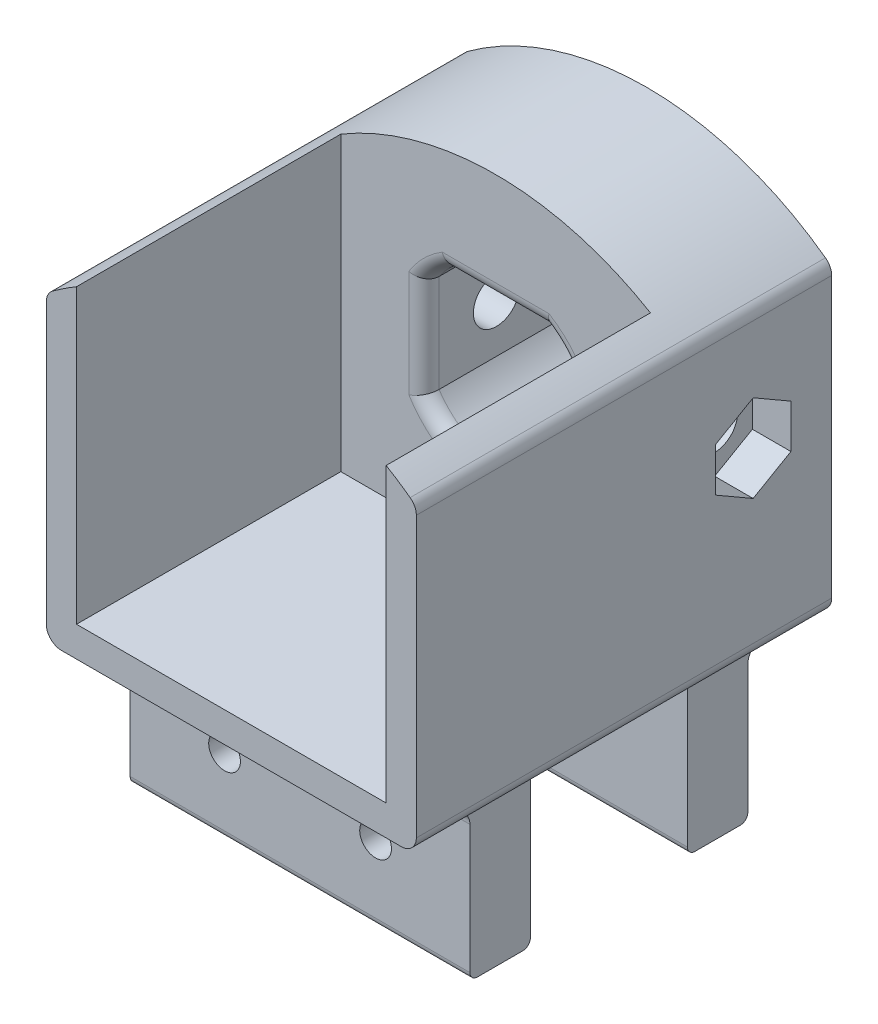
from build123d import *
from build123d.topology import SkipClean

# Parameters (mm, degrees)
EXTRUDE_1_DEPTH          = 20
EXTRUDE_2_DEPTH          = 35
FILLET_1_R               = 2
FILLET_2_R               = 2
SKETCH_3_W               = 55
SKETCH_3_H               = 8
EXTRUDE_3_DEPTH          = 20
CUT_EXTRUDE_1_DEPTH      = 81.785122448
FILLET_3_R               = 2
CUT_EXTRUDE_2_DEPTH      = 92.549767886
CUT_EXTRUDE_2_DEPTH_BACK = 92.549767886
SKETCH_6_R               = 3.05
CUT_EXTRUDE_3_DEPTH      = 5.1
FILLET_3_OF_MIRROR_1_R   = 2
CUT_EXTRUDE_4_DEPTH      = 75.837223358
CUT_EXTRUDE_4_DEPTH_BACK = 75.837223358
SKETCH_9_R               = 1.6
SKETCH_10_R              = 3
CUT_EXTRUDE_5_DEPTH      = 3
CUT_EXTRUDE_START        = -2
SKETCH_11_R              = 3
CUT_EXTRUDE_6_DEPTH      = 2
CUT_EXTRUDE_7_DEPTH      = 75.837223358
CUT_EXTRUDE_7_DEPTH_BACK = 75.837223358
SKETCH_12_W              = 29.59816484
SKETCH_12_H              = 37.248372047
SKETCH_12_W_2            = 30.6542071
SKETCH_12_H_2            = 41.472541085
SKETCH_13_W              = 45
SKETCH_13_H              = 8
EXTRUDE_4_DEPTH          = 20
CUT_EXTRUDE_8_DEPTH      = 69.398976601
CUT_EXTRUDE_8_DEPTH_BACK = 69.398976601
SKETCH_14_R              = 2.1
FILLET_5_R               = 1
FILLET_6_R               = 2


with BuildPart() as part:
    # 草图1 → 凸台-拉伸1 (new body)
    with BuildSketch(Plane.XY):
        with BuildLine():
            Line((-24.5, -24.4), (24.5, -24.4))
            Line((24.5, -24.4), (24.5, 15.6))
            ThreePointArc((24.5, 15.6), (0, 23.936691271), (-24.5, 15.6))
            Line((-24.5, 15.6), (-24.5, -24.4))
        make_face()
        with BuildLine():
            Line((-6.480740698, 9.5), (6.480740698, 9.5))
            ThreePointArc((6.480740698, 9.5), (8.131727984, 8.131727984), (9.5, 6.480740698))
            Line((9.5, 6.480740698), (9.5, -6.480740698))
            ThreePointArc((9.5, -6.480740698), (8.131727984, -8.131727984), (6.480740698, -9.5))
            Line((6.480740698, -9.5), (-6.480740698, -9.5))
            ThreePointArc((-6.480740698, -9.5), (-8.131727984, -8.131727984), (-9.5, -6.480740698))
            Line((-9.5, -6.480740698), (-9.5, 6.480740698))
            ThreePointArc((-9.5, 6.480740698), (-8.131727984, 8.131727984), (-6.480740698, 9.5))
        make_face(mode=Mode.SUBTRACT)
    extrude(amount=EXTRUDE_1_DEPTH)

    # 草图2 → 凸台-拉伸2 (add)
    with SkipClean():  # the faces are left unmerged after this step: merging them gives an invalid solid
        with BuildSketch(Plane.XY.offset(20)):
            with BuildLine():
                Line((-20.5, 18.311818868), (-20.5, -20.4))
                Line((-20.5, -20.4), (20.5, -20.4))
                Line((20.5, -20.4), (20.5, 18.311818868))
                ThreePointArc((20.5, 18.311818868), (22.540818317, 17.016117462), (24.5, 15.6))
                Line((24.5, 15.6), (24.5, -24.4))
                Line((24.5, -24.4), (-24.5, -24.4))
                Line((-24.5, -24.4), (-24.5, 15.6))
                ThreePointArc((-24.5, 15.6), (-22.540818317, 17.016117462), (-20.5, 18.311818868))
            make_face()
        extrude(amount=EXTRUDE_2_DEPTH)

    # 圆角1
    fillet_1_edges = [part.edges().sort_by_distance(p)[0] for p in [
        (-24.5, 15.6, 37.5),
        (24.5, 15.6, 37.5),
        (24.5, -24.4, 37.5),
        (-24.5, -24.4, 37.5),
    ]]
    fillet(fillet_1_edges, radius=FILLET_1_R)

    # 圆角2
    fillet_2_edges = [part.edges().sort_by_distance(p)[0] for p in [
        (8.131727984, 8.131727984, 20),
        (0, 9.5, 20),
        (-8.131727984, 8.131727984, 20),
        (-9.5, 0, 20),
        (-8.131727984, -8.131727984, 20),
        (0, -9.5, 20),
        (8.131727984, -8.131727984, 20),
        (9.5, 0, 20),
    ]]
    fillet(fillet_2_edges, radius=FILLET_2_R)

    # 草图3 → 凸台-拉伸3 (add)
    with SkipClean():  # the faces are left unmerged after this step: merging them gives an invalid solid
        with BuildSketch(Plane.ZY.offset(24.5)):
            with Locations((27.5, 10.599820628)):
                Rectangle(SKETCH_3_W, SKETCH_3_H)
            with Locations((27.5, -18.000179372)):
                Rectangle(SKETCH_3_W, SKETCH_3_H)
        extrude_3 = extrude(amount=EXTRUDE_3_DEPTH)

    # 草图4 → 切除-拉伸1 (cut, symmetric)
    with SkipClean():  # the faces are left unmerged after this step: merging them gives an invalid solid
        with BuildSketch(Plane(origin=(0, 14.599820628, 0), x_dir=(1, 0, 0), z_dir=(0, 1, 0))):
            with BuildLine():
                Line((-39.25, -11.75), (-29.75, -11.75))
                ThreePointArc((-29.75, -11.75), (-29.042893219, -12.042893219), (-28.75, -12.75))
                Line((-28.75, -12.75), (-28.75, -17.25))
                ThreePointArc((-28.75, -17.25), (-29.042893219, -17.957106781), (-29.75, -18.25))
                Line((-29.75, -18.25), (-39.25, -18.25))
                ThreePointArc((-39.25, -18.25), (-39.957106781, -17.957106781), (-40.25, -17.25))
                Line((-40.25, -17.25), (-40.25, -12.75))
                ThreePointArc((-40.25, -12.75), (-39.957106781, -12.042893219), (-39.25, -11.75))
            make_face()
            with BuildLine():
                Line((-39.25, -36.75), (-29.75, -36.75))
                ThreePointArc((-29.75, -36.75), (-29.042893219, -37.042893219), (-28.75, -37.75))
                Line((-28.75, -37.75), (-28.75, -42.25))
                ThreePointArc((-28.75, -42.25), (-29.042893219, -42.957106781), (-29.75, -43.25))
                Line((-29.75, -43.25), (-39.25, -43.25))
                ThreePointArc((-39.25, -43.25), (-39.957106781, -42.957106781), (-40.25, -42.25))
                Line((-40.25, -42.25), (-40.25, -37.75))
                ThreePointArc((-40.25, -37.75), (-39.957106781, -37.042893219), (-39.25, -36.75))
            make_face()
        cut_extrude_1 = extrude(amount=CUT_EXTRUDE_1_DEPTH, both=True, mode=Mode.SUBTRACT)

    # 圆角3
    fillet_3_edges = [part.edges().sort_by_distance(p)[0] for p in [
        (-44.5, 6.599820628, 27.5),
        (-44.5, 14.599820628, 27.5),
        (-44.5, -14.000179372, 27.5),
        (-44.5, -22.000179372, 27.5),
    ]]
    fillet(fillet_3_edges, radius=FILLET_3_R)

    # 草图6 → 切除-拉伸2 (cut, two sides: drawn at the far end of the back side and taken through both)
    with BuildSketch(Plane(origin=(24.5, 0, 0), x_dir=(0, 0, -1), z_dir=(1, 0, 0)).offset(-CUT_EXTRUDE_2_DEPTH_BACK)):
        with Locations(Location((-10.4, 0, 0), (0, 0, 270))):
            Circle(SKETCH_6_R)
    extrude(amount=CUT_EXTRUDE_2_DEPTH + CUT_EXTRUDE_2_DEPTH_BACK, mode=Mode.SUBTRACT)

    # 草图7 → 切除-拉伸3 (cut)
    with BuildSketch(Plane(origin=(24.5, 0, 0), x_dir=(0, 0, -1), z_dir=(1, 0, 0))):
        Polygon((-5.4, -2.886751346), (-5.4, 2.886751346), (-10.4, 5.773502692), (-15.4, 2.886751346), (-15.4, -2.886751346), (-10.4, -5.773502692), align=None)
    cut_extrude_3 = extrude(amount=-CUT_EXTRUDE_3_DEPTH, mode=Mode.SUBTRACT)

    # 镜向1: 凸台-拉伸3, 切除-拉伸1, 切除-拉伸3 across plane
    add(extrude_3.mirror(Plane(origin=(0, 0, 0), x_dir=(0, 0, 1), z_dir=(1, 0, 0))))
    add(cut_extrude_1.mirror(Plane(origin=(0, 0, 0), x_dir=(0, 0, 1), z_dir=(1, 0, 0))), mode=Mode.SUBTRACT)
    add(cut_extrude_3.mirror(Plane(origin=(0, 0, 0), x_dir=(0, 0, 1), z_dir=(1, 0, 0))), mode=Mode.SUBTRACT)

    # 圆角3 of 镜向1
    fillet_3_of_mirror_1_edges = [part.edges().sort_by_distance(p)[0] for p in [
        (44.5, 6.599820628, 27.5),
        (44.5, 14.599820628, 27.5),
        (44.5, -14.000179372, 27.5),
        (44.5, -22.000179372, 27.5),
    ]]
    fillet(fillet_3_of_mirror_1_edges, radius=FILLET_3_OF_MIRROR_1_R)

    # 草图9 → 切除-拉伸4 (cut, two sides: drawn at the far end of the back side and taken through both)
    with BuildSketch(Plane(origin=(0, 0, 0), x_dir=(-1, 0, 0), z_dir=(0, 0, -1)).offset(-CUT_EXTRUDE_4_DEPTH_BACK)):
        with Locations((34.5, -18.000179372)):
            Circle(SKETCH_9_R)
        with Locations((34.5, 10.599820628)):
            Circle(SKETCH_9_R)
        with Locations((-34.5, 10.599820628)):
            Circle(SKETCH_9_R)
        with Locations((-34.5, -18.000179372)):
            Circle(SKETCH_9_R)
    extrude(amount=CUT_EXTRUDE_4_DEPTH + CUT_EXTRUDE_4_DEPTH_BACK, mode=Mode.SUBTRACT)

    # 草图10 → 切除-拉伸5 (cut)
    with BuildSketch(Plane(origin=(0, 0, 0), x_dir=(-1, 0, 0), z_dir=(0, 0, -1))):
        with Locations((34.5, 10.599820628)):
            Circle(SKETCH_10_R)
        with Locations((34.5, -18.000179372)):
            Circle(SKETCH_10_R)
        with Locations((-34.5, -18.000179372)):
            Circle(SKETCH_10_R)
        with Locations((-34.5, 10.599820628)):
            Circle(SKETCH_10_R)
    extrude(amount=-CUT_EXTRUDE_5_DEPTH, mode=Mode.SUBTRACT)

    # 草图11 → 切除-拉伸6 (cut)
    with BuildSketch(Plane.XY.offset(55).offset(CUT_EXTRUDE_START)):
        with Locations(Location((34.5, 10.599820628, 0), (0, 0, 180))):
            Circle(SKETCH_11_R)
        with Locations(Location((34.5, -18.000179372, 0), (0, 0, 180))):
            Circle(SKETCH_11_R)
        with Locations(Location((-34.5, -18.000179372, 0), (0, 0, 180))):
            Circle(SKETCH_11_R)
        with Locations(Location((-34.5, 10.599820628, 0), (0, 0, 180))):
            Circle(SKETCH_11_R)
    extrude(amount=CUT_EXTRUDE_6_DEPTH, mode=Mode.SUBTRACT)

    # 草图12 → 切除-拉伸7 (cut, two sides: drawn at the far end of the back side and taken through both)
    with BuildSketch(Plane(origin=(0, 0, 0), x_dir=(-1, 0, 0), z_dir=(0, 0, -1)).offset(-CUT_EXTRUDE_7_DEPTH_BACK)):
        with Locations((-39.29908242, -4.024365395)):
            Rectangle(SKETCH_12_W, SKETCH_12_H)
        with Locations((39.82710355, -6.136449915)):
            Rectangle(SKETCH_12_W_2, SKETCH_12_H_2)
    extrude(amount=CUT_EXTRUDE_7_DEPTH + CUT_EXTRUDE_7_DEPTH_BACK, mode=Mode.SUBTRACT)

    # 草图13 → 凸台-拉伸4 (add)
    with BuildSketch(Plane.XZ.offset(24.4)):
        with Locations((0, 41.9)):
            Rectangle(SKETCH_13_W, SKETCH_13_H)
        with Locations((0, 13.1)):
            Rectangle(SKETCH_13_W, SKETCH_13_H)
    extrude(amount=EXTRUDE_4_DEPTH)

    # 草图14 → 切除-拉伸8 (cut, two sides: drawn at the far end of the back side and taken through both)
    with BuildSketch(Plane.XY.offset(45.9).offset(-CUT_EXTRUDE_8_DEPTH_BACK)):
        with Locations((-10, -34.4)):
            Circle(SKETCH_14_R)
        with Locations((10, -34.4)):
            Circle(SKETCH_14_R)
    extrude(amount=CUT_EXTRUDE_8_DEPTH + CUT_EXTRUDE_8_DEPTH_BACK, mode=Mode.SUBTRACT)

    # 圆角5
    fillet_5_edges = [part.edges().sort_by_distance(p)[0] for p in [
        (0, -44.4, 37.9),
        (0, -44.4, 45.9),
        (0, -44.4, 9.1),
        (0, -44.4, 17.1),
    ]]
    fillet(fillet_5_edges, radius=FILLET_5_R)

    # 圆角6
    # the kernel refuses this fillet: 2 mm, written as the material it adds along each edge
    with BuildSketch(Plane(origin=(-22.5, -24.4, 45.9), x_dir=(0, -1, 0), z_dir=(1, 0, 0))) as fillet_6_piece_1:
        with BuildLine():
            CenterArc((FILLET_6_R, -FILLET_6_R), FILLET_6_R, 90, 90)
            Line((0, -FILLET_6_R), (0, 0))
            Line((0, 0), (FILLET_6_R, 0))
        make_face()
    extrude(amount=45)
    with BuildSketch(Plane(origin=(22.5, -24.4, 9.1), x_dir=(0, 0, -1), z_dir=(-1, 0, 0))) as fillet_6_piece_2:
        with BuildLine():
            CenterArc((FILLET_6_R, FILLET_6_R), FILLET_6_R, 180, 90)
            Line((0, FILLET_6_R), (0, 0))
            Line((0, 0), (FILLET_6_R, 0))
        make_face()
    extrude(amount=45)


solid = part.part
